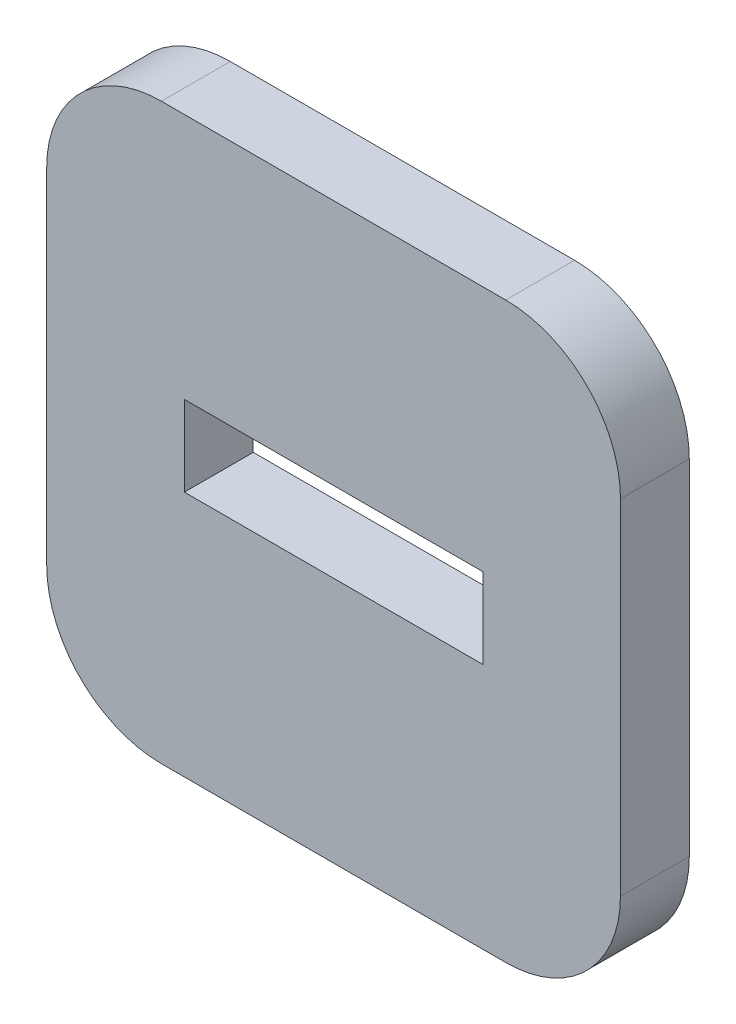
from build123d import *

# Parameters (mm, degrees)
SKETCH1_W           = 25.4
SKETCH1_H           = 25.4
SKETCH1_W_2         = 13.208
SKETCH1_H_2         = 3.556
BOSS_EXTRUDE1_DEPTH = 3.048
FILLET1_R           = 5.08


with BuildPart() as part:
    # Sketch1 → Boss-Extrude1 (new body)
    with BuildSketch(Plane.XY):
        with Locations((-135.757414923, 0)):
            Rectangle(SKETCH1_W, SKETCH1_H)
        with Locations((-135.757414923, 0)):
            Rectangle(SKETCH1_W_2, SKETCH1_H_2, mode=Mode.SUBTRACT)
    extrude(amount=-BOSS_EXTRUDE1_DEPTH)

    # Fillet1
    fillet1_edges = [part.edges().sort_by_distance(p)[0] for p in [
        (-148.457414923, -12.7, -1.524),
        (-123.057414923, -12.7, -1.524),
        (-123.057414923, 12.7, -1.524),
        (-148.457414923, 12.7, -1.524),
    ]]
    fillet(fillet1_edges, radius=FILLET1_R)


solid = part.part
